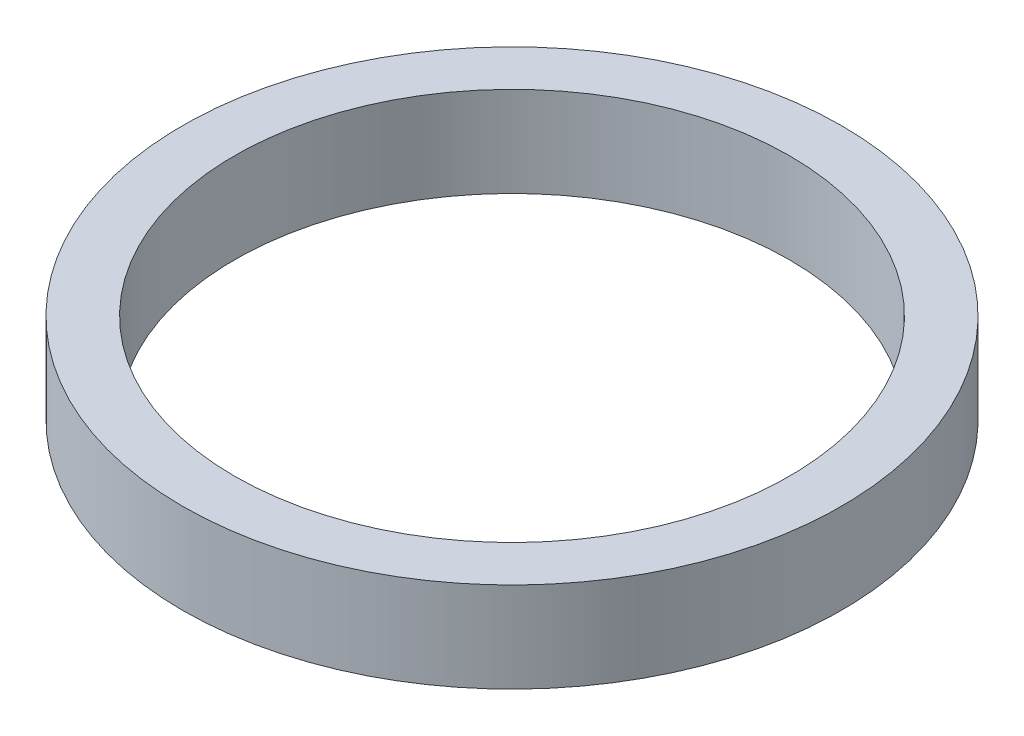
from build123d import *

# Parameters (mm, degrees)
SKETCH1_R           = 47.5
BOSS_EXTRUDE1_DEPTH = 13
SKETCH2_R           = 40
CUT_EXTRUDE1_DEPTH  = 69.421487853


with BuildPart() as part:
    # Sketch1 → Boss-Extrude1 (new body)
    with BuildSketch(Plane(origin=(0, 0, 0), x_dir=(1, 0, 0), z_dir=(0, 1, 0))):
        Circle(SKETCH1_R)
    extrude(amount=BOSS_EXTRUDE1_DEPTH)

    # Sketch2 → Cut-Extrude1 (cut, through all)
    with BuildSketch(Plane(origin=(0, 0, 0), x_dir=(1, 0, 0), z_dir=(0, 1, 0))):
        Circle(SKETCH2_R)
    extrude(amount=CUT_EXTRUDE1_DEPTH, mode=Mode.SUBTRACT)


solid = part.part
